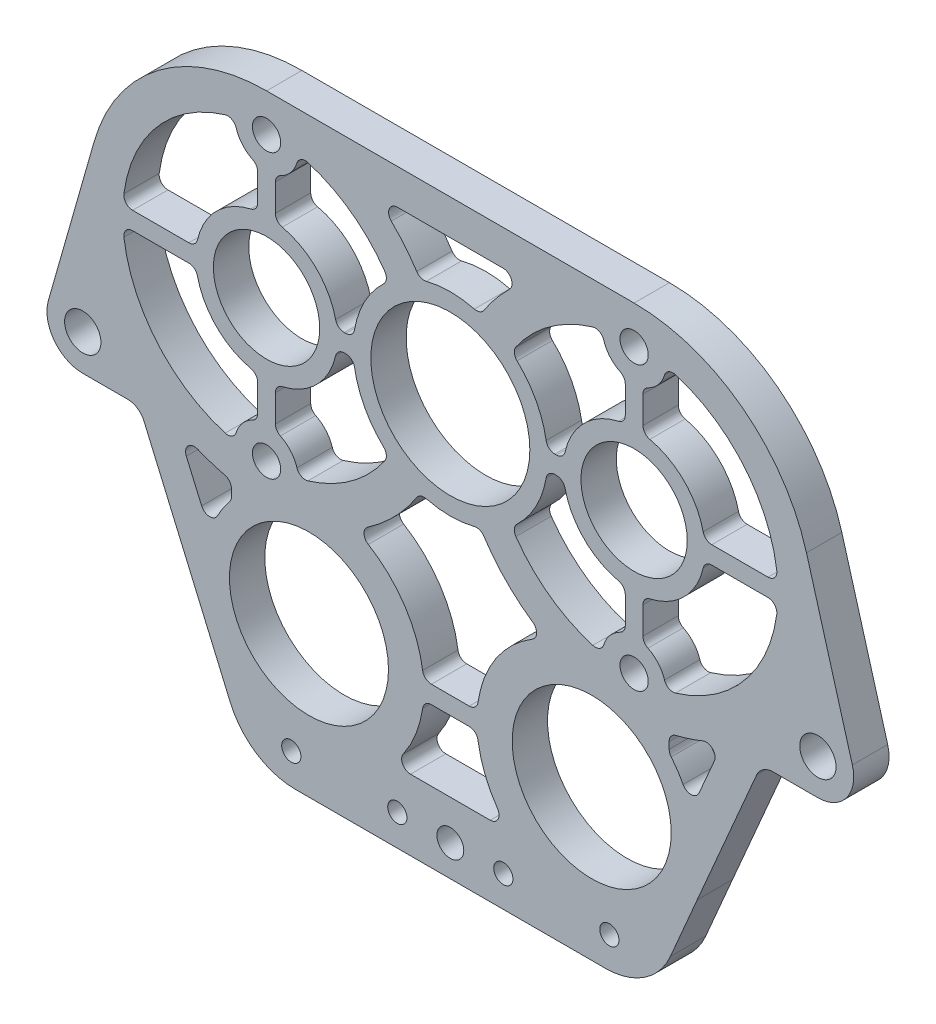
from build123d import *

# Parameters (mm, degrees)
SKETCH1_R           = 1.7272
SKETCH1_R_2         = 3.2639
SKETCH1_R_3         = 14.2875
SKETCH1_R_4         = 2.54
SKETCH1_R_5         = 2.413
SKETCH1_R_6         = 9.5504
BOSS_EXTRUDE1_DEPTH = 6.35
FILLET1_R           = 12.7
FILLET2_R           = 1.5875
FILLET3_R           = 1.5875
FILLET4_R           = 1.5875
FILLET5_R           = 1.5875


with BuildPart() as part:
    # Sketch1 → Boss-Extrude1 (new body)
    with BuildSketch(Plane.XY):
        with BuildLine():
            ThreePointArc((-88.650082996, -56.773293074), (-88.69014681, -56.910298001), (-88.729603024, -57.047479146))
            Line((-88.729603024, -57.047479146), (-96.969555254, -85.936940817))
            ThreePointArc((-96.969555254, -85.936940817), (-95.917203646, -91.581675778), (-90.777596546, -94.141932707))
            Line((-90.777596546, -94.141932707), (-82.731084461, -94.141932707))
            ThreePointArc((-82.731084461, -94.141932707), (-80.96163914, -94.671787652), (-79.774622093, -96.086946138))
            Line((-79.774622093, -96.086946138), (-69.089278393, -120.875011159))
            Line((-69.089278393, -120.875011159), (-60.977424177, -139.773032707))
            Line((-60.977424177, -139.773032707), (11.502231084, -139.773032707))
            Line((11.502231084, -139.773032707), (19.6140853, -120.875011159))
            Line((19.6140853, -120.875011159), (30.299429001, -96.086946138))
            ThreePointArc((30.299429001, -96.086946138), (31.486446047, -94.671787652), (33.255891369, -94.141932707))
            Line((33.255891369, -94.141932707), (41.302403454, -94.141932707))
            ThreePointArc((41.302403454, -94.141932707), (46.442010554, -91.581675778), (47.494362162, -85.936940817))
            Line((47.494362162, -85.936940817), (39.254409932, -57.047479146))
            ThreePointArc((39.254409932, -57.047479146), (39.214953717, -56.910298001), (39.174889904, -56.773293074))
            ThreePointArc((39.174889904, -56.773293074), (27.569139848, -40.087517091), (8.282403454, -33.674222013))
            Line((8.282403454, -33.674222013), (-57.757596546, -33.674222013))
            ThreePointArc((-57.757596546, -33.674222013), (-77.04433294, -40.087517091), (-88.650082996, -56.773293074))
        make_face()
        with Locations((-53.312596546, -134.185032707)):
            Circle(SKETCH1_R, mode=Mode.SUBTRACT)
        with Locations((-34.262596546, -134.185032707)):
            Circle(SKETCH1_R, mode=Mode.SUBTRACT)
        with BuildLine():
            ThreePointArc((-19.913948264, -114.373032707), (-18.174388615, -121.216527358), (-14.229666584, -127.073032707))
            Line((-14.229666584, -127.073032707), (-35.245526509, -127.073032707))
            ThreePointArc((-35.245526509, -127.073032707), (-31.300804477, -121.216527358), (-29.561244829, -114.373032707))
            Line((-29.561244829, -114.373032707), (-19.913948264, -114.373032707))
        make_face(mode=Mode.SUBTRACT)
        with BuildLine():
            Line((-67.920135277, -107.552502272), (-73.889402884, -93.757371434))
            ThreePointArc((-73.889402884, -93.757371434), (-69.125593396, -96.015661334), (-64.057187193, -97.466527514))
            Line((-64.057187193, -97.466527514), (-64.057187193, -100.544279198))
            ThreePointArc((-64.057187193, -100.544279198), (-66.371359185, -103.837446777), (-67.920135277, -107.552502272))
        make_face(mode=Mode.SUBTRACT)
        with Locations((-90.777596546, -87.703032707)):
            Circle(SKETCH1_R_2, mode=Mode.SUBTRACT)
        with Locations((-50.137596546, -112.785532707)):
            Circle(SKETCH1_R_3, mode=Mode.SUBTRACT)
        with Locations((-57.757596546, -91.281422013)):
            Circle(SKETCH1_R_4, mode=Mode.SUBTRACT)
        with Locations((-24.737596546, -134.185032707)):
            Circle(SKETCH1_R_5, mode=Mode.SUBTRACT)
        with Locations((-15.212596546, -134.185032707)):
            Circle(SKETCH1_R, mode=Mode.SUBTRACT)
        with Locations((3.837403454, -134.185032707)):
            Circle(SKETCH1_R, mode=Mode.SUBTRACT)
        with Locations((0.662403454, -112.785532707)):
            Circle(SKETCH1_R_3, mode=Mode.SUBTRACT)
        with BuildLine():
            Line((-19.913948264, -111.198032707), (-29.561244829, -111.198032707))
            ThreePointArc((-29.561244829, -111.198032707), (-33.30837049, -100.840510455), (-41.849292426, -93.885521568))
            ThreePointArc((-41.849292426, -93.885521568), (-35.26870111, -88.93686202), (-30.157880835, -82.481404678))
            ThreePointArc((-30.157880835, -82.481404678), (-24.737596546, -83.343922013), (-19.317312258, -82.481404678))
            ThreePointArc((-19.317312258, -82.481404678), (-14.206491982, -88.93686202), (-7.625900666, -93.885521568))
            ThreePointArc((-7.625900666, -93.885521568), (-16.166822602, -100.840510455), (-19.913948264, -111.198032707))
        make_face(mode=Mode.SUBTRACT)
        with Locations((8.282403454, -91.281422013)):
            Circle(SKETCH1_R_4, mode=Mode.SUBTRACT)
        with BuildLine():
            ThreePointArc((14.581994101, -97.466527514), (19.650400303, -96.015661334), (24.414209791, -93.757371434))
            Line((24.414209791, -93.757371434), (18.444942185, -107.552502272))
            ThreePointArc((18.444942185, -107.552502272), (16.896166093, -103.837446777), (14.581994101, -100.544279198))
            Line((14.581994101, -100.544279198), (14.581994101, -97.466527514))
        make_face(mode=Mode.SUBTRACT)
        with Locations((41.302403454, -87.703032707)):
            Circle(SKETCH1_R_2, mode=Mode.SUBTRACT)
        with BuildLine():
            Line((-59.345096546, -78.50741302), (-59.345096546, -85.791333785))
            ThreePointArc((-59.345096546, -85.791333785), (-62.270471472, -87.774972968), (-63.469709832, -91.099799313))
            ThreePointArc((-63.469709832, -91.099799313), (-77.455074137, -82.632665799), (-83.566018342, -67.468922013))
            Line((-83.566018342, -67.468922013), (-70.383587553, -67.468922013))
            ThreePointArc((-70.383587553, -67.468922013), (-66.755813179, -74.879638646), (-59.345096546, -78.50741302))
        make_face(mode=Mode.SUBTRACT)
        with BuildLine():
            ThreePointArc((-52.04548326, -91.099799313), (-53.24472162, -87.774972968), (-56.170096546, -85.791333785))
            Line((-56.170096546, -85.791333785), (-56.170096546, -78.50741302))
            ThreePointArc((-56.170096546, -78.50741302), (-48.759379913, -74.879638646), (-45.131605539, -67.468922013))
            Line((-45.131605539, -67.468922013), (-42.127787747, -67.468922013))
            ThreePointArc((-42.127787747, -67.468922013), (-40.144805677, -74.10071718), (-35.740996219, -79.441071783))
            ThreePointArc((-35.740996219, -79.441071783), (-42.717587518, -86.914560635), (-52.04548326, -91.099799313))
        make_face(mode=Mode.SUBTRACT)
        with Locations((-57.757596546, -65.881422013)):
            Circle(SKETCH1_R_6, mode=Mode.SUBTRACT)
        with BuildLine():
            ThreePointArc((-59.345096546, -53.255431006), (-66.755813179, -56.88320538), (-70.383587553, -64.293922013))
            Line((-70.383587553, -64.293922013), (-83.566018342, -64.293922013))
            ThreePointArc((-83.566018342, -64.293922013), (-77.455074137, -49.130178227), (-63.469709832, -40.663044713))
            ThreePointArc((-63.469709832, -40.663044713), (-62.270471472, -43.987871058), (-59.345096546, -45.971510241))
            Line((-59.345096546, -45.971510241), (-59.345096546, -53.255431006))
        make_face(mode=Mode.SUBTRACT)
        with BuildLine():
            Line((-56.170096546, -53.255431006), (-56.170096546, -45.971510241))
            ThreePointArc((-56.170096546, -45.971510241), (-53.24472162, -43.987871058), (-52.04548326, -40.663044713))
            ThreePointArc((-52.04548326, -40.663044713), (-42.717587518, -44.848283391), (-35.740996219, -52.321772243))
            ThreePointArc((-35.740996219, -52.321772243), (-40.144805677, -57.662126846), (-42.127787747, -64.293922013))
            Line((-42.127787747, -64.293922013), (-45.131605539, -64.293922013))
            ThreePointArc((-45.131605539, -64.293922013), (-48.759379913, -56.88320538), (-56.170096546, -53.255431006))
        make_face(mode=Mode.SUBTRACT)
        with Locations((-57.757596546, -40.481422013)):
            Circle(SKETCH1_R_4, mode=Mode.SUBTRACT)
        with BuildLine():
            Line((-38.555801318, -40.024222013), (-10.919391775, -40.024222013))
            ThreePointArc((-10.919391775, -40.024222013), (-15.571723543, -44.241543153), (-19.317312258, -49.281439348))
            ThreePointArc((-19.317312258, -49.281439348), (-24.737596546, -48.418922013), (-30.157880835, -49.281439348))
            ThreePointArc((-30.157880835, -49.281439348), (-33.90346955, -44.241543153), (-38.555801318, -40.024222013))
        make_face(mode=Mode.SUBTRACT)
        with BuildLine():
            Line((-7.347405345, -67.468922013), (-4.343587553, -67.468922013))
            ThreePointArc((-4.343587553, -67.468922013), (-0.715813179, -74.879638646), (6.694903454, -78.50741302))
            Line((6.694903454, -78.50741302), (6.694903454, -85.791333785))
            ThreePointArc((6.694903454, -85.791333785), (3.769528528, -87.774972968), (2.570290168, -91.099799313))
            ThreePointArc((2.570290168, -91.099799313), (-6.757605574, -86.914560635), (-13.734196873, -79.441071783))
            ThreePointArc((-13.734196873, -79.441071783), (-9.330387415, -74.10071718), (-7.347405345, -67.468922013))
        make_face(mode=Mode.SUBTRACT)
        with Locations((-24.737596546, -65.881422013)):
            Circle(SKETCH1_R_3, mode=Mode.SUBTRACT)
        with Locations((8.282403454, -65.881422013)):
            Circle(SKETCH1_R_6, mode=Mode.SUBTRACT)
        with BuildLine():
            ThreePointArc((9.869903454, -78.50741302), (17.280620087, -74.879638646), (20.908394461, -67.468922013))
            Line((20.908394461, -67.468922013), (34.09082525, -67.468922013))
            ThreePointArc((34.09082525, -67.468922013), (27.979881045, -82.632665799), (13.99451674, -91.099799313))
            ThreePointArc((13.99451674, -91.099799313), (12.79527838, -87.774972968), (9.869903454, -85.791333785))
            Line((9.869903454, -85.791333785), (9.869903454, -78.50741302))
        make_face(mode=Mode.SUBTRACT)
        with BuildLine():
            ThreePointArc((6.694903454, -53.255431006), (-0.715813179, -56.88320538), (-4.343587553, -64.293922013))
            Line((-4.343587553, -64.293922013), (-7.347405345, -64.293922013))
            ThreePointArc((-7.347405345, -64.293922013), (-9.330387415, -57.662126846), (-13.734196873, -52.321772243))
            ThreePointArc((-13.734196873, -52.321772243), (-6.757605574, -44.848283391), (2.570290168, -40.663044713))
            ThreePointArc((2.570290168, -40.663044713), (3.769528528, -43.987871058), (6.694903454, -45.971510241))
            Line((6.694903454, -45.971510241), (6.694903454, -53.255431006))
        make_face(mode=Mode.SUBTRACT)
        with Locations((8.282403454, -40.481422013)):
            Circle(SKETCH1_R_4, mode=Mode.SUBTRACT)
        with BuildLine():
            Line((9.869903454, -53.255431006), (9.869903454, -45.971510241))
            ThreePointArc((9.869903454, -45.971510241), (12.79527838, -43.987871058), (13.99451674, -40.663044713))
            ThreePointArc((13.99451674, -40.663044713), (27.979881045, -49.130178227), (34.09082525, -64.293922013))
            Line((34.09082525, -64.293922013), (20.908394461, -64.293922013))
            ThreePointArc((20.908394461, -64.293922013), (17.280620087, -56.88320538), (9.869903454, -53.255431006))
        make_face(mode=Mode.SUBTRACT)
    extrude(amount=BOSS_EXTRUDE1_DEPTH)

    # Fillet1
    fillet1_edges = [part.edges().sort_by_distance(p)[0] for p in [
        (-60.977424177, -139.773032707, 3.175),
        (11.502231084, -139.773032707, 3.175),
    ]]
    fillet(fillet1_edges, radius=FILLET1_R)

    # Fillet2
    fillet2_edges = [part.edges().sort_by_distance(p)[0] for p in [
        (-63.469709832, -91.099799313, 3.175),
        (-59.345096546, -85.791333785, 3.175),
        (-52.04548326, -91.099799313, 3.175),
        (-56.170096546, -85.791333785, 3.175),
        (-35.740996219, -79.441071783, 3.175),
        (-59.345096546, -78.50741302, 3.175),
        (-56.170096546, -78.50741302, 3.175),
        (-45.131605539, -67.468922013, 3.175),
        (-42.127787747, -67.468922013, 3.175),
        (-59.345096546, -45.971510241, 3.175),
        (-45.131605539, -64.293922013, 3.175),
        (-42.127787747, -64.293922013, 3.175),
        (-35.740996219, -52.321772243, 3.175),
        (-56.170096546, -45.971510241, 3.175),
        (-56.170096546, -53.255431006, 3.175),
        (-59.345096546, -53.255431006, 3.175),
        (-70.383587553, -64.293922013, 3.175),
        (-70.383587553, -67.468922013, 3.175),
        (-83.566018342, -67.468922013, 3.175),
        (-83.566018342, -64.293922013, 3.175),
        (-52.04548326, -40.663044713, 3.175),
        (-63.469709832, -40.663044713, 3.175),
    ]]
    fillet(fillet2_edges, radius=FILLET2_R)

    # Fillet3
    fillet3_edges = [part.edges().sort_by_distance(p)[0] for p in [
        (13.99451674, -91.099799313, 3.175),
        (9.869903454, -85.791333785, 3.175),
        (2.570290168, -91.099799313, 3.175),
        (6.694903454, -85.791333785, 3.175),
        (-13.734196873, -79.441071783, 3.175),
        (9.869903454, -78.50741302, 3.175),
        (-7.347405345, -67.468922013, 3.175),
        (-4.343587553, -67.468922013, 3.175),
        (6.694903454, -78.50741302, 3.175),
        (34.09082525, -67.468922013, 3.175),
        (20.908394461, -67.468922013, 3.175),
        (34.09082525, -64.293922013, 3.175),
        (9.869903454, -45.971510241, 3.175),
        (13.99451674, -40.663044713, 3.175),
        (20.908394461, -64.293922013, 3.175),
        (9.869903454, -53.255431006, 3.175),
        (-7.347405345, -64.293922013, 3.175),
        (-4.343587553, -64.293922013, 3.175),
        (6.694903454, -53.255431006, 3.175),
        (-13.734196873, -52.321772243, 3.175),
        (6.694903454, -45.971510241, 3.175),
        (2.570290168, -40.663044713, 3.175),
    ]]
    fillet(fillet3_edges, radius=FILLET3_R)

    # Fillet4
    fillet4_edges = [part.edges().sort_by_distance(p)[0] for p in [
        (-35.245526509, -127.073032707, 3.175),
        (-14.229666584, -127.073032707, 3.175),
        (-19.913948264, -114.373032707, 3.175),
        (-29.561244829, -114.373032707, 3.175),
        (-29.561244829, -111.198032707, 3.175),
        (-19.913948264, -111.198032707, 3.175),
        (-7.625900666, -93.885521568, 3.175),
        (-41.849292426, -93.885521568, 3.175),
        (-19.317312258, -82.481404678, 3.175),
        (-30.157880835, -82.481404678, 3.175),
        (-19.317312258, -49.281439348, 3.175),
        (-30.157880835, -49.281439348, 3.175),
        (-10.919391775, -40.024222013, 3.175),
        (-38.555801318, -40.024222013, 3.175),
    ]]
    fillet(fillet4_edges, radius=FILLET4_R)

    # Fillet5
    fillet5_edges = [part.edges().sort_by_distance(p)[0] for p in [
        (24.414209791, -93.757371434, 3.175),
        (18.444942185, -107.552502272, 3.175),
        (14.581994101, -100.544279198, 3.175),
        (14.581994101, -97.466527514, 3.175),
        (-73.889402884, -93.757371434, 3.175),
        (-64.057187193, -97.466527514, 3.175),
        (-67.920135277, -107.552502272, 3.175),
        (-64.057187193, -100.544279198, 3.175),
    ]]
    fillet(fillet5_edges, radius=FILLET5_R)


solid = part.part
